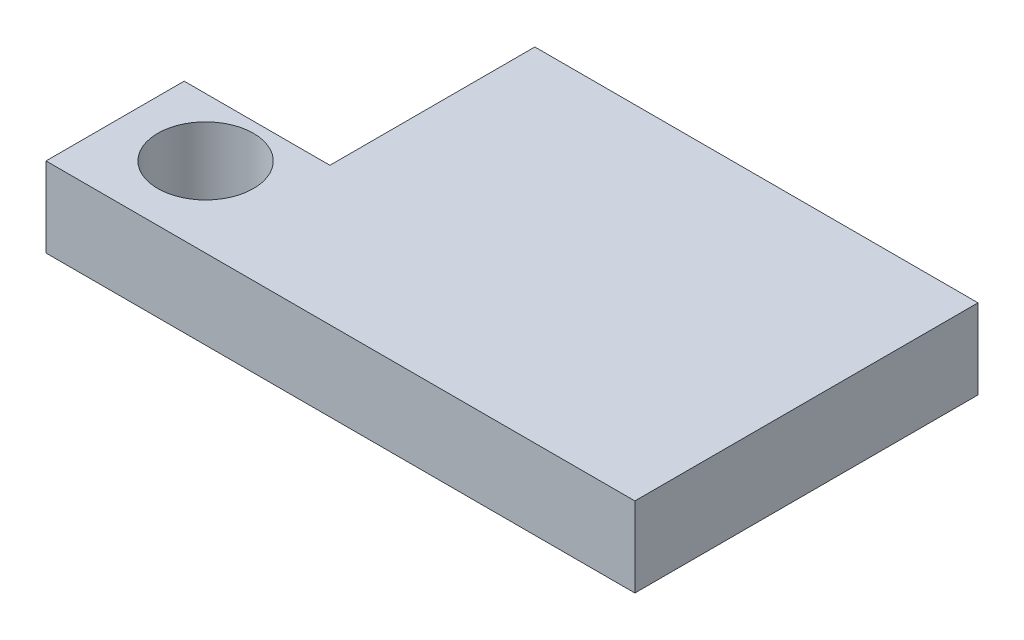
from build123d import *

# Parameters (mm, degrees)
SKETCH1_W           = 1106.97250468
SKETCH1_H           = 150
BOSS_EXTRUDE1_DEPTH = 645
SKETCH2_R           = 90
CUT_EXTRUDE1_DEPTH  = 1290.927566229
SKETCH3_W           = 273.936328983
SKETCH3_H           = 385.258703225
CUT_EXTRUDE2_DEPTH  = 1290.927566229


with BuildPart() as part:
    # Sketch1 → Boss-Extrude1 (new body)
    with BuildSketch(Plane.XY):
        with Locations((553.48625234, 75)):
            Rectangle(SKETCH1_W, SKETCH1_H)
    extrude(amount=BOSS_EXTRUDE1_DEPTH)

    # Sketch2 → Cut-Extrude1 (cut, through all)
    with BuildSketch(Plane.XZ):
        with Locations((150, 495)):
            Circle(SKETCH2_R)
    extrude(amount=-CUT_EXTRUDE1_DEPTH, mode=Mode.SUBTRACT)

    # Sketch3 → Cut-Extrude2 (cut, through all)
    with BuildSketch(Plane.XZ):
        with Locations((136.968164492, 192.629351613)):
            Rectangle(SKETCH3_W, SKETCH3_H)
    extrude(amount=-CUT_EXTRUDE2_DEPTH, mode=Mode.SUBTRACT)


solid = part.part
